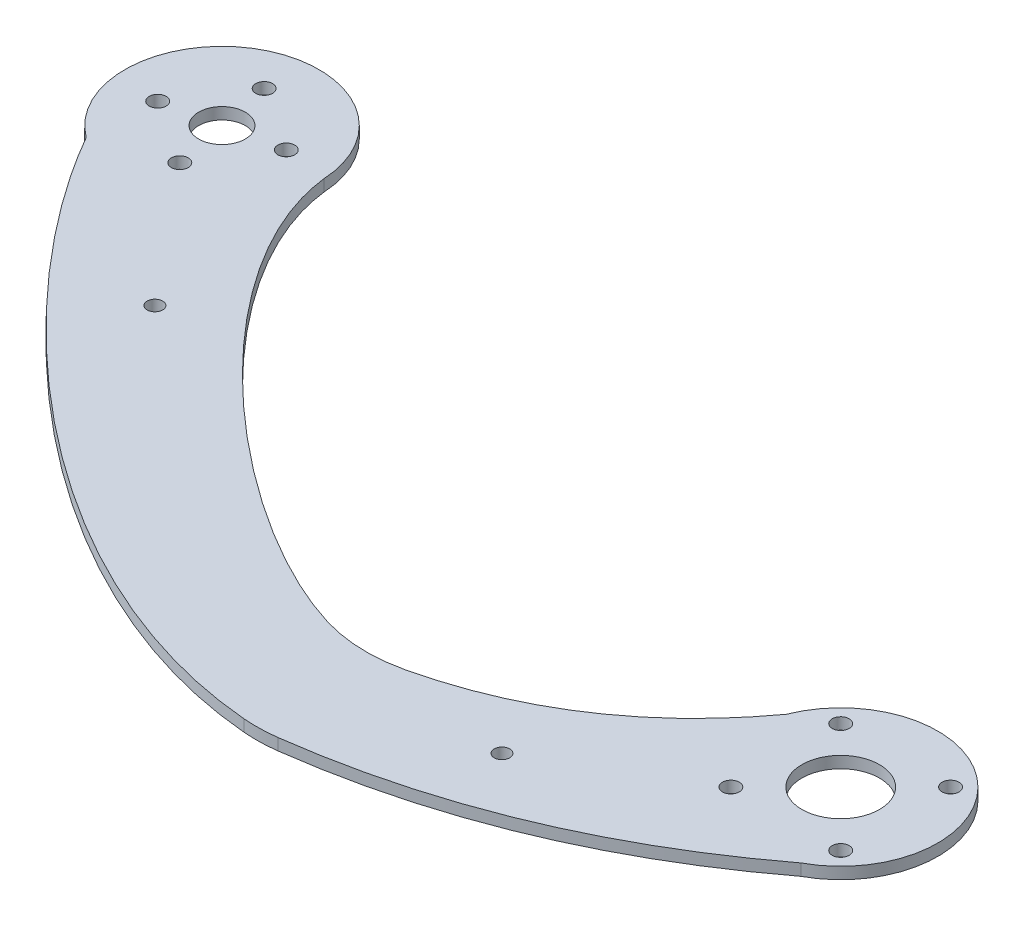
from build123d import *

# Parameters (mm, degrees)
BOSS_EXTRUDE1_DEPTH = 1.5
FILLET2_R           = 20
FILLET3_R           = 20
SKETCH3_R           = 5
SKETCH3_R_2         = 1.09
SKETCH3_R_3         = 3
CUT_EXTRUDE2_DEPTH  = 10
SKETCH4_R           = 1
CUT_EXTRUDE3_DEPTH  = 10


with BuildPart() as part:
    # Sketch2 → Boss-Extrude1 (new body)
    with BuildSketch(Plane(origin=(0, 0, 0), x_dir=(1, 0, 0), z_dir=(0, 1, 0))):
        with BuildLine():
            ThreePointArc((5.892711217, -11.0238811), (8.326059469, 9.323450741), (-11.617581648, 4.613219771))
            add(Edge.make_bspline(
                [(-44.514894976, -15.648119029), (-23.754992487, -12.049932399), (-11.617581648, 4.613219771)],
                knots=[0, 0, 0, 1, 1, 1], degree=2))
            add(Edge.make_bspline(
                [(-44.514894976, -15.648119029), (-60.493246192, -16.620966096), (-98.719374485, 13.99401616), (-101.099323327, 34.577284328)],
                knots=[0, 0, 0, 0, 1, 1, 1, 1], degree=3))
            ThreePointArc((-101.099323327, 34.577284328), (-119.514224633, 44.92723863), (-120.988196928, 23.854565571))
            add(Edge.make_bspline(
                [(-43.715031798, -30.941916126), (-74.6558876, -29.772176263), (-107.934743734, 0.909272839), (-120.988196928, 23.854565571)],
                knots=[0, 0, 0, 0, 1, 1, 1, 1], degree=3))
            add(Edge.make_bspline(
                [(5.892711217, -11.0238811), (-16.208282922, -27.819747246), (-43.715031798, -30.941916126)],
                knots=[0, 0, 0, 1, 1, 1], degree=2))
        make_face()
    extrude(amount=BOSS_EXTRUDE1_DEPTH)

    # Fillet2
    # the kernel refuses this fillet: 20 mm, written as the material it adds along each edge
    with BuildSketch(Plane(origin=(-44.514894976, 0, 15.648119029), x_dir=(0.9799001058370423, 0, -0.1994888031458243), z_dir=(0, 1, 0))) as fillet2_piece_1:
        with BuildLine():
            CenterArc((2.930109572, 19.991048267), FILLET2_R, 241.517996045, 30.196325972)
            Line((-6.607544605, 2.411709462), (-6.798297688, 2.060122686))
            ThreePointArc((-6.798297688, 2.060122686), (-3.555192588, 0.548576642), (-0.055827526, -0.39608495))
            Line((-0.055827526, -0.39608495), (-0.011685269, -0.399829282))
            ThreePointArc((-0.011685269, -0.399829282), (1.764140792, -0.426085985), (3.540398002, -0.399820965))
            Line((3.540398002, -0.399820965), (3.528431562, 0))
        make_face()
    extrude(amount=1.5)

    # Fillet3
    fillet3_edges = [part.edges().sort_by_distance(p)[0] for p in [
        (-43.715031798, 0.75, 30.941916126),
    ]]
    fillet(fillet3_edges, radius=FILLET3_R)

    # Sketch3 → Cut-Extrude2 (cut)
    with BuildSketch(Plane(origin=(0, 1.5, 0), x_dir=(1, 0, 0), z_dir=(0, 1, 0))):
        with Locations(Location((0, 0, 0), (0, 0, 270))):
            Circle(SKETCH3_R)
        with Locations(Location((-7.071067812, 7.071067812, 0), (0, 0, 270))):
            Circle(SKETCH3_R_2)
        with Locations(Location((7.071067812, 7.071067812, 0), (0, 0, 270))):
            Circle(SKETCH3_R_2)
        with Locations(Location((7.071067812, -7.071067812, 0), (0, 0, 270))):
            Circle(SKETCH3_R_2)
        with Locations(Location((-7.071067812, -7.071067812, 0), (0, 0, 270))):
            Circle(SKETCH3_R_2)
        with Locations(Location((-113.582262859, 33.924428557, 0), (0, 0, 270))):
            Circle(SKETCH3_R_3)
        with Locations(Location((-106.728711554, 35.34880018, 0), (0, 0, 270))):
            Circle(SKETCH3_R_2)
        with Locations(Location((-112.157891236, 27.070877253, 0), (0, 0, 270))):
            Circle(SKETCH3_R_2)
        with Locations(Location((-120.435814163, 32.500056934, 0), (0, 0, 270))):
            Circle(SKETCH3_R_2)
        with Locations(Location((-115.006634482, 40.777979862, 0), (0, 0, 270))):
            Circle(SKETCH3_R_2)
    extrude(amount=-CUT_EXTRUDE2_DEPTH, mode=Mode.SUBTRACT)

    # Sketch4 → Cut-Extrude3 (cut)
    with BuildSketch(Plane(origin=(0, 1.5, 0), x_dir=(1, 0, 0), z_dir=(0, 1, 0))):
        with Locations(Location((-97.840235061, 9.542968429, 0), (0, 0, 270))):
            Circle(SKETCH4_R)
        with Locations(Location((-25.561724323, -18.05130401, 0), (0, 0, 270))):
            Circle(SKETCH4_R)
    extrude(amount=-CUT_EXTRUDE3_DEPTH, mode=Mode.SUBTRACT)


solid = part.part
